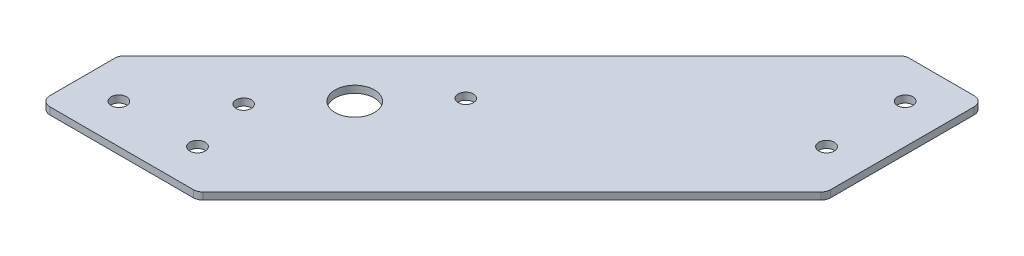
from build123d import *

# Parameters (mm, degrees)
SKETCH1_R                    = 2.4892
SKETCH1_R_2                  = 6.35
BOSS_EXTRUDE2_DEPTH          = 1.143
CUT_EXTRUDE1_DEPTH           = 216.53826991
BOSS_EXTRUDE3_DEPTH          = 2.286
FILLET3_R                    = 3.175
F_10_0_1935_DIAMETER_HOLE1_D = 4.9149


with BuildPart() as part:
    # Sketch1 → Boss-Extrude2 (new, symmetric)
    with BuildSketch(Plane(origin=(0, 0, 0), x_dir=(1, 0, 0), z_dir=(0, 1, 0))):
        Polygon((0, 0), (0, 152.4), (-25.4, 152.4), (-152.4, 25.4), (-152.4, 0), align=None)
        with Locations((-12.7, 12.7)):
            Circle(SKETCH1_R, mode=Mode.SUBTRACT)
        with Locations((-38.1, 12.7)):
            Circle(SKETCH1_R, mode=Mode.SUBTRACT)
        with Locations((-63.5, 12.7)):
            Circle(SKETCH1_R, mode=Mode.SUBTRACT)
        with Locations((-88.9, 12.7)):
            Circle(SKETCH1_R, mode=Mode.SUBTRACT)
        with Locations((-114.3, 12.7)):
            Circle(SKETCH1_R, mode=Mode.SUBTRACT)
        with Locations((-12.7, 38.1)):
            Circle(SKETCH1_R, mode=Mode.SUBTRACT)
        with Locations((-12.7, 63.5)):
            Circle(SKETCH1_R, mode=Mode.SUBTRACT)
        with Locations((-12.7, 88.9)):
            Circle(SKETCH1_R, mode=Mode.SUBTRACT)
        with Locations((-12.7, 114.3)):
            Circle(SKETCH1_R, mode=Mode.SUBTRACT)
        with Locations((-139.7, 12.7)):
            Circle(SKETCH1_R, mode=Mode.SUBTRACT)
        with Locations((-12.7, 139.7)):
            Circle(SKETCH1_R, mode=Mode.SUBTRACT)
        with Locations((-101.6, 50.8)):
            Circle(SKETCH1_R_2, mode=Mode.SUBTRACT)
    extrude(amount=BOSS_EXTRUDE2_DEPTH, both=True)

    # Sketch2 → Cut-Extrude1 (cut, through all)
    with BuildSketch(Plane(origin=(0, 1.143, 0), x_dir=(1, 0, 0), z_dir=(0, 1, 0))):
        Polygon((0, 0), (0, 101.6), (-101.6, 0), align=None)
    extrude(amount=-CUT_EXTRUDE1_DEPTH, mode=Mode.SUBTRACT)

    # Sketch3 → Boss-Extrude3 (add)
    with BuildSketch(Plane(origin=(0, 1.143, 0), x_dir=(1, 0, 0), z_dir=(0, 1, 0))):
        Polygon((-101.6, 0), (-101.6, 15.120409187), (-15.612291765, 101.108117422), (0, 101.6), align=None)
    extrude(amount=-BOSS_EXTRUDE3_DEPTH)

    # Fillet3
    fillet3_edges = [part.edges().sort_by_distance(p)[0] for p in [
        (-152.4, 0, 0),
        (-25.4, 0, -152.4),
        (0, 0, -152.4),
        (0, 0, -101.6),
        (-101.6, 0, 0),
        (-152.4, 0, -25.4),
    ]]
    fillet(fillet3_edges, radius=FILLET3_R)

    # #10 (0.1935) Diameter Hole1 (through all)
    with Locations(Plane(origin=(0, 1.143, 0), x_dir=(1, 0, 0), z_dir=(0, 1, 0))):
        with Locations((-118.726441846, 32.042468454), (-84.473558154, 69.557531546), (-101.6, 50.8)):
            Hole(F_10_0_1935_DIAMETER_HOLE1_D / 2)


solid = part.part
